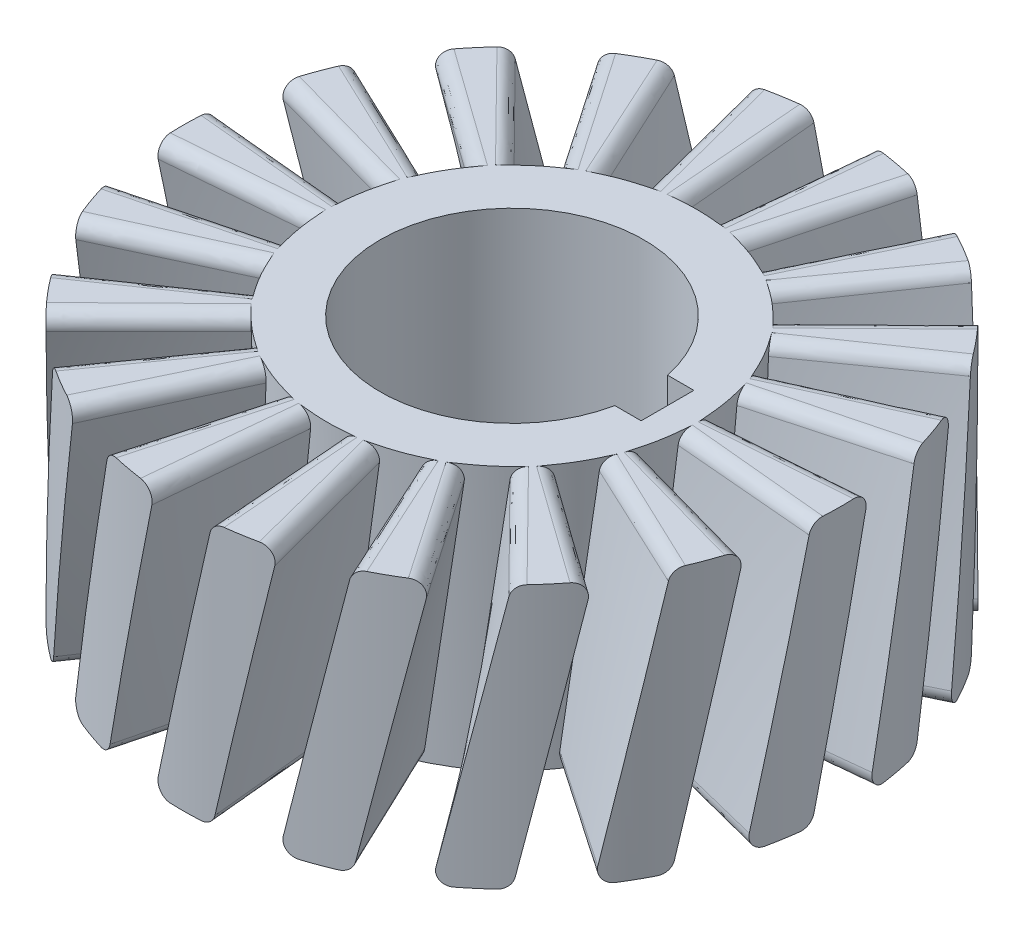
from build123d import *

# Parameters (mm, degrees)
SKETCH1_R                = 37.5
BOSS_EXTRUDE1_DEPTH      = 30
SKETCH2_R                = 15
CUT_EXTRUDE1_DEPTH       = 61.930288035
FILLET2_R                = 1.5
CIRPATTERN3_COUNT        = 18
FILLET2_OF_CIRPATTERN3_R = 1.5
CUT_EXTRUDE2_DEPTH       = 61.930288207


with BuildPart() as part:
    # Sketch1 → Boss-Extrude1 (new body)
    with BuildSketch(Plane(origin=(0, 0, 0), x_dir=(1, 0, 0), z_dir=(0, 1, 0))):
        Circle(SKETCH1_R)
    extrude(amount=BOSS_EXTRUDE1_DEPTH)

    # Sketch2 → Cut-Extrude1 (cut, through all)
    with BuildSketch(Plane(origin=(0, 30, 0), x_dir=(1, 0, 0), z_dir=(0, 1, 0))):
        Circle(SKETCH2_R)
    extrude(amount=-CUT_EXTRUDE1_DEPTH, mode=Mode.SUBTRACT)

    # Sketch4 for Cut-Loft1 → Cut-Loft1 section 0
    with BuildSketch(Plane(origin=(0, 0, 0), x_dir=(1, 0, 0), z_dir=(0, 1, 0))):
        with BuildLine():
            Line((20.92008866, 1.830270598), (38.353495877, 3.355496096))
            # circular arc as an exact rational Bezier (weights 1, cos(half-angle), 1)
            Bezier((38.353495877, 3.355496096), (38.647063745, 0), (38.353495877, -3.355496096), weights=[1, 0.996194698, 1])
            Line((38.353495877, -3.355496096), (20.92008866, -1.830270598))
            Bezier((20.92008866, -1.830270598), (21.080216588, 0), (20.92008866, 1.830270598), weights=[1, 0.996194698, 1])
        make_face()
    # Sketch7 for Cut-Loft1 → Cut-Loft1 section 1
    with BuildSketch(Plane(origin=(0, 30, 0), x_dir=(1, 0, 0), z_dir=(0, 1, 0))):
        with BuildLine():
            Line((20.284442352, 5.435199947), (37.188144312, 9.964533236))
            Bezier((37.188144312, 9.964533236), (38.059928008, 6.710992192), (38.353495877, 3.355496096), weights=[1, 0.996194698, 1])
            Line((38.353495877, 3.355496096), (20.92008866, 1.830270598))
            Bezier((20.92008866, 1.830270598), (20.759960731, 3.660541195), (20.284442352, 5.435199947), weights=[1, 0.996194698, 1])
        make_face()
    cut_loft1 = loft(mode=Mode.SUBTRACT)

    # Fillet2
    fillet2_edges = [part.edges().sort_by_distance(p)[0] for p in [
        (29.138694919, 30, -2.549305475),
        (28.253330419, 30, -7.570457069),
        (29.138694919, 0, 2.549305475),
        (29.138694919, 0, -2.549305475),
    ]]
    fillet(fillet2_edges, radius=FILLET2_R)

    # CirPattern3: Cut-Loft1 ×18 about axis
    cirpattern3_axis = Axis((0, -0.7, 0), (0, 1, 0))
    for i in range(1, CIRPATTERN3_COUNT):
        add(cut_loft1.rotate(cirpattern3_axis, i * 360 / CIRPATTERN3_COUNT), mode=Mode.SUBTRACT)

    # Fillet2 of CirPattern3
    fillet2_of_cirpattern3_edges = [part.edges().sort_by_distance(p)[0] for p in [
        (26.509502771, 30, -12.361584156),
        (23.960197295, 30, -16.777110763),
        (28.253330419, 0, -7.570457069),
        (26.509502771, 0, -12.361584156),
        (20.68287335, 30, -20.68287335),
        (16.777110763, 30, -23.960197295),
        (23.960197295, 0, -16.777110763),
        (20.68287335, 0, -20.68287335),
        (12.361584156, 30, -26.509502771),
        (7.570457069, 30, -28.253330419),
        (16.777110763, 0, -23.960197295),
        (12.361584156, 0, -26.509502771),
        (2.549305475, 30, -29.138694919),
        (-2.549305475, 30, -29.138694919),
        (7.570457069, 0, -28.253330419),
        (2.549305475, 0, -29.138694919),
        (-7.570457069, 30, -28.253330419),
        (-12.361584156, 30, -26.509502771),
        (-2.549305475, 0, -29.138694919),
        (-7.570457069, 0, -28.253330419),
        (-16.777110763, 30, -23.960197295),
        (-20.68287335, 30, -20.68287335),
        (-12.361584156, 0, -26.509502771),
        (-16.777110763, 0, -23.960197295),
        (-23.960197295, 30, -16.777110763),
        (-26.509502771, 30, -12.361584156),
        (-20.68287335, 0, -20.68287335),
        (-23.960197295, 0, -16.777110763),
        (-28.253330419, 30, -7.570457069),
        (-29.138694919, 30, -2.549305475),
        (-26.509502771, 0, -12.361584156),
        (-28.253330419, 0, -7.570457069),
        (-29.138694919, 30, 2.549305475),
        (-28.253330419, 30, 7.570457069),
        (-29.138694919, 0, -2.549305475),
        (-29.138694919, 0, 2.549305475),
        (-26.509502771, 30, 12.361584156),
        (-23.960197295, 30, 16.777110763),
        (-28.253330419, 0, 7.570457069),
        (-26.509502771, 0, 12.361584156),
        (-20.68287335, 30, 20.68287335),
        (-16.777110763, 30, 23.960197295),
        (-23.960197295, 0, 16.777110763),
        (-20.68287335, 0, 20.68287335),
        (-12.361584156, 30, 26.509502771),
        (-7.570457069, 30, 28.253330419),
        (-16.777110763, 0, 23.960197295),
        (-12.361584156, 0, 26.509502771),
        (-2.549305475, 30, 29.138694919),
        (2.549305475, 30, 29.138694919),
        (-7.570457069, 0, 28.253330419),
        (-2.549305475, 0, 29.138694919),
        (7.570457069, 30, 28.253330419),
        (12.361584156, 30, 26.509502771),
        (2.549305475, 0, 29.138694919),
        (7.570457069, 0, 28.253330419),
        (16.777110763, 30, 23.960197295),
        (20.68287335, 30, 20.68287335),
        (12.361584156, 0, 26.509502771),
        (16.777110763, 0, 23.960197295),
        (23.960197295, 30, 16.777110763),
        (26.509502771, 30, 12.361584156),
        (20.68287335, 0, 20.68287335),
        (23.960197295, 0, 16.777110763),
        (28.253330419, 30, 7.570457069),
        (29.138694919, 30, 2.549305475),
        (26.509502771, 0, 12.361584156),
        (28.253330419, 0, 7.570457069),
    ]]
    fillet(fillet2_of_cirpattern3_edges, radius=FILLET2_OF_CIRPATTERN3_R)

    # Sketch8 → Cut-Extrude2 (cut, through all)
    with BuildSketch(Plane(origin=(0, 0, 0), x_dir=(1, 0, 0), z_dir=(0, 1, 0))):
        with BuildLine():
            Line((14.696938457, 3), (17.696938457, 3))
            Line((17.696938457, 3), (17.696938457, -3))
            Line((17.696938457, -3), (14.696938457, -3))
            ThreePointArc((14.696938457, -3), (15, 0), (14.696938457, 3))
        make_face()
    extrude(amount=CUT_EXTRUDE2_DEPTH, mode=Mode.SUBTRACT)


solid = part.part
